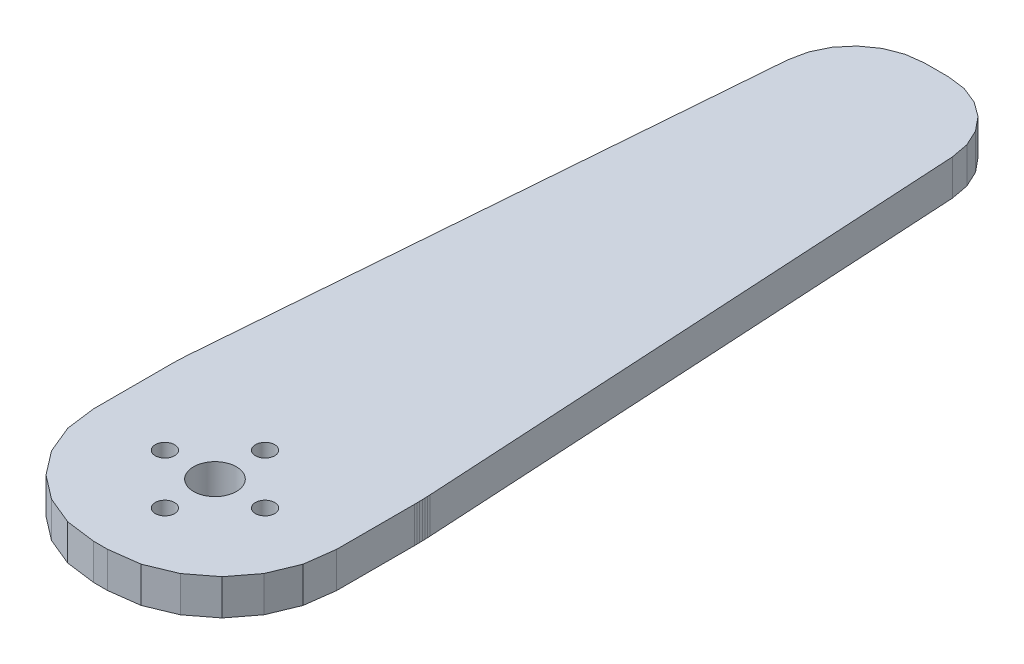
from build123d import *

# Parameters (mm, degrees)
BOSS_1_DEPTH = 5
S_HOLE2_R    = 3
HOLE_2_DEPTH = 5.2
S_HOLE3_R    = 1.35
HOLE_3_DEPTH = 5.2
S_HOLE4_R    = 1.35
HOLE_4_DEPTH = 5.2
S_HOLE5_R    = 1.35
HOLE_5_DEPTH = 5.2
S_HOLE6_R    = 1.35
HOLE_6_DEPTH = 5.2


with BuildPart() as part:
    # S_prism1 → Boss_1 (new body)
    with BuildSketch(Plane(origin=(0, 0, 0), x_dir=(1, 0, 0), z_dir=(0, 1, 0))):
        Polygon((-17, 0), (-16.455, -4.141), (-14.856, -8), (-12.314, -11.314), (-9, -13.856), (-5.141, -15.455), (-1, -16), (1, -16), (5.141, -15.455), (9, -13.856), (12.314, -11.314), (14.856, -8), (16.455, -4.141), (17, 0), (17, 10.865), (16.998, 11.243), (16.993, 11.621), (16.984, 12), (16.971, 12.378), (16.955, 12.756), (16.936, 13.134), (12.536, 90.567), (12.078, 93.042), (11.017, 95.324), (9.42, 97.269), (7.387, 98.753), (5.049, 99.683), (2.552, 100), (-0.764, 100), (-3.224, 99.693), (-5.533, 98.79), (-7.549, 97.346), (-9.148, 95.451), (-10.231, 93.221), (-10.732, 90.793), (-16.874, 13.583), (-16.913, 13.056), (-16.944, 12.527), (-16.968, 11.999), (-16.986, 11.47), (-16.996, 10.941), (-17, 10.412), align=None)
    extrude(amount=BOSS_1_DEPTH)

    # S_hole2 → Hole_2 (cut)
    with BuildSketch(Plane(origin=(0, -0.1, 0), x_dir=(1, 0, 0), z_dir=(0, 1, 0))):
        Circle(S_HOLE2_R)
    extrude(amount=HOLE_2_DEPTH, mode=Mode.SUBTRACT)

    # S_hole3 → Hole_3 (cut)
    with BuildSketch(Plane(origin=(0, -0.1, 0), x_dir=(1, 0, 0), z_dir=(0, 1, 0))):
        with Locations((7, 0)):
            Circle(S_HOLE3_R)
    extrude(amount=HOLE_3_DEPTH, mode=Mode.SUBTRACT)

    # S_hole4 → Hole_4 (cut)
    with BuildSketch(Plane(origin=(0, -0.1, 0), x_dir=(1, 0, 0), z_dir=(0, 1, 0))):
        with Locations((0, -7)):
            Circle(S_HOLE4_R)
    extrude(amount=HOLE_4_DEPTH, mode=Mode.SUBTRACT)

    # S_hole5 → Hole_5 (cut)
    with BuildSketch(Plane(origin=(0, -0.1, 0), x_dir=(1, 0, 0), z_dir=(0, 1, 0))):
        with Locations((-7, 0)):
            Circle(S_HOLE5_R)
    extrude(amount=HOLE_5_DEPTH, mode=Mode.SUBTRACT)

    # S_hole6 → Hole_6 (cut)
    with BuildSketch(Plane(origin=(0, -0.1, 0), x_dir=(1, 0, 0), z_dir=(0, 1, 0))):
        with Locations((0, 7)):
            Circle(S_HOLE6_R)
    extrude(amount=HOLE_6_DEPTH, mode=Mode.SUBTRACT)


solid = part.part
